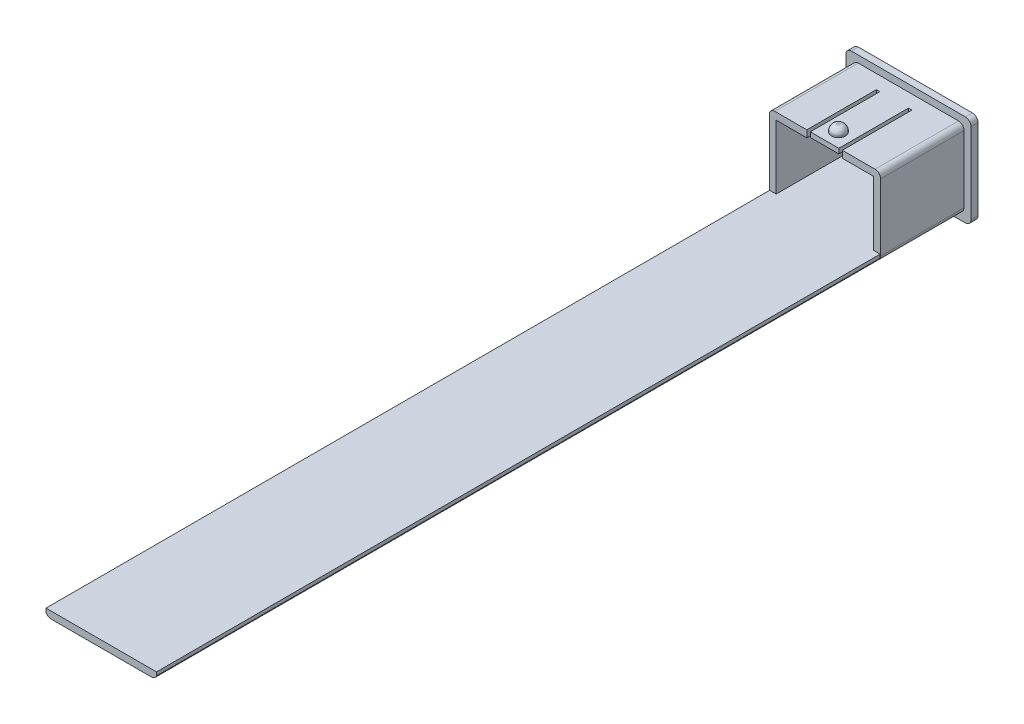
from build123d import *

# Parameters (mm, degrees)
SKETCH1_W           = 25.4
SKETCH1_H           = 17.78
BOSS_EXTRUDE1_DEPTH = 19.05
SKETCH2_W           = 25.4
SKETCH2_H           = 0.79375
BOSS_EXTRUDE2_DEPTH = 165.1
SKETCH3_W           = 28.575
SKETCH3_H           = 20.955
BOSS_EXTRUDE3_DEPTH = 1.5875
SKETCH4_W           = 22.167429019
SKETCH4_H           = 15.39875
CUT_EXTRUDE1_DEPTH  = 19.05
CUT_EXTRUDE2_DEPTH  = 1.5875
SKETCH8_W           = 7.9375
SKETCH8_H           = 4.7625
CUT_EXTRUDE3_DEPTH  = 1.5875
FILLET9_R           = 1.27
FILLET10_R          = 1.27
FILLET11_R          = 1.27
FILLET12_R          = 1.27
FILLET13_R          = 1.27
FILLET14_R          = 1.27
FILLET15_R          = 1.27
FILLET16_R          = 1.27
SKETCH9_W           = 0.79375
SKETCH9_H           = 15.875
CUT_EXTRUDE5_DEPTH  = 1.5875
SKETCH11_W          = 0.79375
SKETCH11_H          = 15.875
CUT_EXTRUDE6_DEPTH  = 1.5875
SKETCH12_W          = 6.50875
SKETCH12_H          = 0.467297544
CUT_EXTRUDE7_DEPTH  = 15.875
SKETCH13_R          = 1.5875
BOSS_EXTRUDE5_DEPTH = 1.5875
FILLET22_R          = 1.27
SKETCH17_W          = 22.167429019
SKETCH17_H          = 19.05
BOSS_EXTRUDE6_DEPTH = 0.79375
SKETCH18_W          = 25.21464302
SKETCH18_H          = 165.1
BOSS_EXTRUDE7_DEPTH = 0.79375


with BuildPart() as part:
    # Sketch1 → Boss-Extrude1 (new body)
    with BuildSketch(Plane.XY):
        with Locations((12.7, 8.89)):
            Rectangle(SKETCH1_W, SKETCH1_H)
    extrude(amount=BOSS_EXTRUDE1_DEPTH)

    # Sketch2 → Boss-Extrude2 (add)
    with BuildSketch(Plane.XY.offset(19.05)):
        with Locations((12.7, 0.396875)):
            Rectangle(SKETCH2_W, SKETCH2_H)
    extrude(amount=BOSS_EXTRUDE2_DEPTH)

    # Sketch3 → Boss-Extrude3 (add)
    with BuildSketch(Plane(origin=(0, 0, 0), x_dir=(-1, 0, 0), z_dir=(0, 0, -1))):
        with Locations((-12.7, 8.89)):
            Rectangle(SKETCH3_W, SKETCH3_H)
    extrude(amount=BOSS_EXTRUDE3_DEPTH)

    # Sketch4 → Cut-Extrude1 (cut)
    with BuildSketch(Plane.XY.offset(19.05)):
        with Locations((12.67121451, 8.493125)):
            Rectangle(SKETCH4_W, SKETCH4_H)
    extrude(amount=-CUT_EXTRUDE1_DEPTH, mode=Mode.SUBTRACT)

    # Sketch5 → Cut-Extrude2 (cut)
    with BuildSketch(Plane(origin=(0, 0, -1.5875), x_dir=(-1, 0, 0), z_dir=(0, 0, -1))):
        Polygon((-11.1125, 15.24), (-11.1125, 8.89), (-11.1125, 2.54), (-3.175, 2.54), (-3.175, 15.24), align=None)
    extrude(amount=-CUT_EXTRUDE2_DEPTH, mode=Mode.SUBTRACT)

    # Sketch8 → Cut-Extrude3 (cut)
    with BuildSketch(Plane(origin=(0, 0, -1.5875), x_dir=(-1, 0, 0), z_dir=(0, 0, -1))):
        with Locations((-19.021212582, 4.92125)):
            Rectangle(SKETCH8_W, SKETCH8_H)
    extrude(amount=-CUT_EXTRUDE3_DEPTH, mode=Mode.SUBTRACT)

    # Fillet9
    fillet9_edges = [part.edges().sort_by_distance(p)[0] for p in [
        (25.4, 17.78, 9.525),
    ]]
    fillet(fillet9_edges, radius=FILLET9_R)

    # Fillet10
    fillet10_edges = [part.edges().sort_by_distance(p)[0] for p in [
        (0, 17.78, 9.525),
    ]]
    fillet(fillet10_edges, radius=FILLET10_R)

    # Fillet11
    # the kernel refuses this fillet: 1.27 mm, written as the material it takes off along each edge
    with BuildSketch(Plane(origin=(25.4, 0, 0), x_dir=(0, 1, 0), z_dir=(0, 0, 1))) as fillet11_piece_1:
        with BuildLine():
            CenterArc((FILLET11_R, FILLET11_R), FILLET11_R, 180, 90)
            Line((0, FILLET11_R), (0, 0))
            Line((0, 0), (FILLET11_R, 0))
        make_face()
    extrude(amount=187.325, mode=Mode.SUBTRACT)

    # Fillet12
    # the kernel refuses this fillet: 1.27 mm, written as the material it takes off along each edge
    with BuildSketch(Plane(origin=(0, 0, 187.325), x_dir=(0, 1, 0), z_dir=(0, 0, -1))) as fillet12_piece_1:
        with BuildLine():
            CenterArc((FILLET12_R, FILLET12_R), FILLET12_R, 180, 90)
            Line((0, FILLET12_R), (0, 0))
            Line((0, 0), (FILLET12_R, 0))
        make_face()
    extrude(amount=187.325, mode=Mode.SUBTRACT)

    # Fillet13
    fillet13_edges = [part.edges().sort_by_distance(p)[0] for p in [
        (-1.5875, -1.5875, -0.79375),
    ]]
    fillet(fillet13_edges, radius=FILLET13_R)

    # Fillet14
    fillet14_edges = [part.edges().sort_by_distance(p)[0] for p in [
        (-1.5875, 19.3675, -0.79375),
    ]]
    fillet(fillet14_edges, radius=FILLET14_R)

    # Fillet15
    fillet15_edges = [part.edges().sort_by_distance(p)[0] for p in [
        (26.9875, -1.5875, -0.79375),
    ]]
    fillet(fillet15_edges, radius=FILLET15_R)

    # Fillet16
    fillet16_edges = [part.edges().sort_by_distance(p)[0] for p in [
        (26.9875, 19.3675, -0.79375),
    ]]
    fillet(fillet16_edges, radius=FILLET16_R)

    # Sketch9 → Cut-Extrude5 (cut)
    with BuildSketch(Plane(origin=(0, 17.78, 0), x_dir=(1, 0, 0), z_dir=(0, 1, 0))):
        with Locations((16.271875, -11.1125)):
            Rectangle(SKETCH9_W, SKETCH9_H)
    extrude(amount=-CUT_EXTRUDE5_DEPTH, mode=Mode.SUBTRACT)

    # Sketch11 → Cut-Extrude6 (cut)
    with BuildSketch(Plane(origin=(0, 17.78, 0), x_dir=(1, 0, 0), z_dir=(0, 1, 0))):
        with Locations((8.969375, -11.1125)):
            Rectangle(SKETCH11_W, SKETCH11_H)
    extrude(amount=-CUT_EXTRUDE6_DEPTH, mode=Mode.SUBTRACT)

    # Sketch12 → Cut-Extrude7 (cut)
    with BuildSketch(Plane.XY.offset(19.05)):
        with Locations((12.620625, 16.426148772)):
            Rectangle(SKETCH12_W, SKETCH12_H)
    extrude(amount=-CUT_EXTRUDE7_DEPTH, mode=Mode.SUBTRACT)

    # Sketch13 → Boss-Extrude5 (add)
    with BuildSketch(Plane(origin=(0, 17.78, 0), x_dir=(1, 0, 0), z_dir=(0, 1, 0))):
        with Locations(Location((12.620625, -15.875, 0), (0, 0, 270))):
            Circle(SKETCH13_R)
    extrude(amount=BOSS_EXTRUDE5_DEPTH)

    # Fillet22
    fillet22_edges = [part.edges().sort_by_distance(p)[0] for p in [
        (12.620625, 19.3675, 14.2875),
    ]]
    fillet(fillet22_edges, radius=FILLET22_R)

    # Sketch17 → Boss-Extrude6 (add)
    with BuildSketch(Plane(origin=(0, 0.79375, 0), x_dir=(1, 0, 0), z_dir=(0, 1, 0))):
        with Locations((12.67121451, -9.525)):
            Rectangle(SKETCH17_W, SKETCH17_H)
    extrude(amount=BOSS_EXTRUDE6_DEPTH)

    # Sketch18 → Boss-Extrude7 (add)
    with BuildSketch(Plane(origin=(0, 0.79375, 0), x_dir=(1, 0, 0), z_dir=(0, 1, 0))):
        with Locations((12.7, -101.6)):
            Rectangle(SKETCH18_W, SKETCH18_H)
    extrude(amount=BOSS_EXTRUDE7_DEPTH)


solid = part.part
